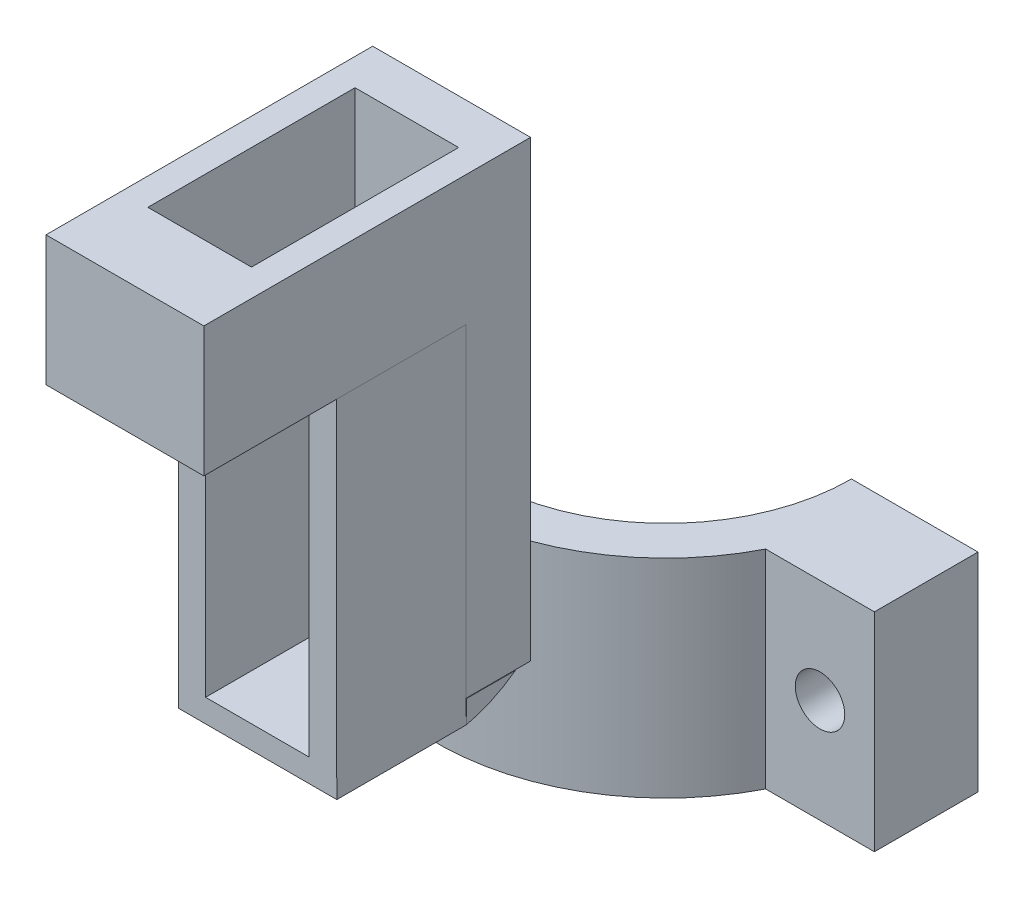
from build123d import *

# Parameters (mm, degrees)
SKETCH_1_R                = 17.63
SKETCH_1_R_2              = 14.34
EXTRUDE_1_DEPTH           = 16.05
EXTRUDE_1_2_DEPTH         = 9.77
EXTRUDE_1_2_DEPTH_BACK    = 3
SKETCH_2_W                = 16
SKETCH_2_H                = 16.05
SKETCH_3_W                = 3.41
SKETCH_3_H                = 16
CUT_EXTRUDE_1_DEPTH       = 37.411121927
SKETCH_4_R                = 1.91
CUT_EXTRUDE_2_DEPTH       = 39.675463798
EXTRUDE_2_DEPTH           = 4
EXTRUDE_2_DEPTH_BACK      = 2.77
SKETCH_5_W                = 12.19
SKETCH_5_H                = 8.263625949
SKETCH_6_W                = 12.19
SKETCH_6_H                = 6.77
EXTRUDE_3_DEPTH           = 63
SKETCH_8_W                = 12.19
SKETCH_8_H                = 6.77
EXTRUDE_4_DEPTH           = 0.16
EXTRUDE_5_DEPTH           = 3.16
EXTRUDE_5_DEPTH_BACK      = 10
SKETCH_12_W               = 16
SKETCH_12_H               = 16.05
SKETCH_13_W               = 1.21
SKETCH_13_H               = 16
CUT_EXTRUDE_3_DEPTH       = 73.543164889
SKETCH_14_R               = 1.91
CUT_EXTRUDE_4_DEPTH       = 90.07387176
SKETCH_15_R               = 4.05
CUT_EXTRUDE_5_DEPTH       = 24
SKETCH_16_W               = 56.400519221
SKETCH_16_H               = 19.935010357
CUT_EXTRUDE_6_DEPTH       = 73.088971918
SKETCH_17_W               = 12.19
SKETCH_17_H               = 71.423625949
EXTRUDE_7_DEPTH           = 25
SKETCH_18_W               = 26.793372528
SKETCH_18_H               = 63.398625949
CUT_EXTRUDE_7_DEPTH       = 25
SKETCH_19_R               = 4
CUT_EXTRUDE_8_DEPTH       = 24
CUT_EXTRUDE_9_DEPTH       = 29
EXTRUDE_9_DEPTH           = 2
FILLET_1_R                = 10
SKETCH_24_W               = 12.19
SKETCH_24_H               = 5
EXTRUDE_10_DEPTH          = 27
SKETCH_27_W               = 12.19
SKETCH_27_H               = 10.03
EXTRUDE_11_DEPTH          = 20.23
CUT_EXTRUDE_10_DEPTH      = 45.23
CUT_EXTRUDE_10_DEPTH_BACK = 8
SKETCH_21_W               = 8
SKETCH_21_H               = 16
SKETCH_25_W               = 20.230462415
SKETCH_25_H               = 10.025
CUT_EXTRUDE_12_DEPTH      = 20.23
SKETCH_31_W               = 8
SKETCH_31_H               = 2.03
EXTRUDE_13_DEPTH          = 16.23
EXTRUDE_17_DEPTH          = 10


with BuildPart() as part:
    # 草圖1 → Extrude 1 (new body)
    with BuildSketch(Plane(origin=(0, 0, 0), x_dir=(1, 0, 0), z_dir=(0, 1, 0))):
        Circle(SKETCH_1_R)
        Circle(SKETCH_1_R_2, mode=Mode.SUBTRACT)
    extrude(amount=EXTRUDE_1_DEPTH)

    # 草圖2 → Extrude 1 2 (add, two sides: drawn at the far end of the back side and taken through both)
    with BuildSketch(Plane(origin=(17.75, 0, 0), x_dir=(0, 0, -1), z_dir=(1, 0, 0)).offset(-EXTRUDE_1_2_DEPTH_BACK)):
        with Locations((0, 8.025)):
            Rectangle(SKETCH_2_W, SKETCH_2_H)
    extrude(amount=EXTRUDE_1_2_DEPTH + EXTRUDE_1_2_DEPTH_BACK)

    # 草圖3 → 除料-伸長1 (cut, through all)
    with BuildSketch(Plane(origin=(0, 16.05, 0), x_dir=(1, 0, 0), z_dir=(0, 1, 0))):
        with Locations((25.815, 0)):
            Rectangle(SKETCH_3_W, SKETCH_3_H)
    extrude(amount=-CUT_EXTRUDE_1_DEPTH, mode=Mode.SUBTRACT)

    # 草圖4 → 除料-伸長2 (cut, through all)
    with BuildSketch(Plane.XY.offset(8)):
        with Locations((19.910203689, 8.025)):
            Circle(SKETCH_4_R)
    extrude(amount=-CUT_EXTRUDE_2_DEPTH, mode=Mode.SUBTRACT)

    # 草圖5 → 填料-伸長2 (add, two sides: drawn at the far end of the back side and taken through both)
    with BuildSketch(Plane.XY.offset(17.75).offset(-EXTRUDE_2_DEPTH_BACK)):
        with Locations((0, 12.156812974)):
            Rectangle(SKETCH_5_W, SKETCH_5_H)
    extrude(amount=EXTRUDE_2_DEPTH + EXTRUDE_2_DEPTH_BACK)

    # 草圖6 → 填料-伸長3 (add)
    with BuildSketch(Plane(origin=(0, 16.288625949, 0), x_dir=(1, 0, 0), z_dir=(0, 1, 0))):
        with Locations((0, -18.365)):
            Rectangle(SKETCH_6_W, SKETCH_6_H)
    extrude(amount=EXTRUDE_3_DEPTH)

    # 草圖8 → 填料-伸長4 (add)
    with BuildSketch(Plane(origin=(0, 79.288625949, 0), x_dir=(1, 0, 0), z_dir=(0, 1, 0))):
        with Locations((0, -18.365)):
            Rectangle(SKETCH_8_W, SKETCH_8_H)
    extrude(amount=EXTRUDE_4_DEPTH)

    # 草圖12 → 填料-伸長5 (add, two sides: drawn at the far end of the back side and taken through both)
    with BuildSketch(Plane(origin=(-17.75, 0, 0), x_dir=(0, 0, -1), z_dir=(1, 0, 0)).offset(-EXTRUDE_5_DEPTH_BACK)):
        with Locations((0.543544944, 8.025)):
            Rectangle(SKETCH_12_W, SKETCH_12_H)
    extrude(amount=EXTRUDE_5_DEPTH + EXTRUDE_5_DEPTH_BACK)

    # 草圖13 → 除料-伸長3 (cut, through all)
    with BuildSketch(Plane(origin=(0, 16.05, 0), x_dir=(1, 0, 0), z_dir=(0, 1, 0))):
        with Locations((-27.145, 0.543544944)):
            Rectangle(SKETCH_13_W, SKETCH_13_H)
    extrude(amount=-CUT_EXTRUDE_3_DEPTH, mode=Mode.SUBTRACT)

    # 草圖14 → 除料-伸長4 (cut, through all)
    with BuildSketch(Plane(origin=(0, 0, -8.543544944), x_dir=(-1, 0, 0), z_dir=(0, 0, -1))):
        with Locations(Location((20.980783679, 8.025, 0), (0, 0, 90))):
            Circle(SKETCH_14_R)
    extrude(amount=-CUT_EXTRUDE_4_DEPTH, mode=Mode.SUBTRACT)

    # 草圖15 → 除料-伸長5 (cut)
    with BuildSketch(Plane(origin=(0, 79.448625949, 0), x_dir=(1, 0, 0), z_dir=(0, 1, 0))):
        with Locations((0, -14.98)):
            Circle(SKETCH_15_R)
    extrude(amount=-CUT_EXTRUDE_5_DEPTH, mode=Mode.SUBTRACT)

    # 草圖16 → 除料-伸長6 (cut, through all)
    with BuildSketch(Plane(origin=(0, 16.05, 0), x_dir=(1, 0, 0), z_dir=(0, 1, 0))):
        with Locations((-4.090259611, 9.967505179)):
            Rectangle(SKETCH_16_W, SKETCH_16_H)
    extrude(amount=-CUT_EXTRUDE_6_DEPTH, mode=Mode.SUBTRACT)

    # 草圖17 → 填料-伸長7 (add)
    with BuildSketch(Plane.XY.offset(21.75)):
        with Locations((0, 43.736812975)):
            Rectangle(SKETCH_17_W, SKETCH_17_H)
    extrude(amount=EXTRUDE_7_DEPTH)

    # 草圖18 → 除料-伸長7 (cut)
    with BuildSketch(Plane.ZY.offset(6.095)):
        with Locations((28.376686264, 47.749312975)):
            Rectangle(SKETCH_18_W, SKETCH_18_H)
    extrude(amount=-CUT_EXTRUDE_7_DEPTH, mode=Mode.SUBTRACT)

    # 草圖19 → 除料-伸長8 (cut)
    with BuildSketch(Plane(origin=(0, 79.448625949, 0), x_dir=(1, 0, 0), z_dir=(0, 1, 0))):
        with Locations((0, -41.773372528)):
            Circle(SKETCH_19_R)
    extrude(amount=-CUT_EXTRUDE_8_DEPTH, mode=Mode.SUBTRACT)

    # 草圖20 → 除料-伸長9 (cut)
    with BuildSketch(Plane(origin=(6.095, 0, 0), x_dir=(0, 0, -1), z_dir=(1, 0, 0))):
        Polygon((-41.773372528, 16.05), (-41.773372528, 8.025), (-46.75, 8.025), (-46.75, 79.448625949), (-41.773372528, 79.448625949), align=None)
    extrude(amount=-CUT_EXTRUDE_9_DEPTH, mode=Mode.SUBTRACT)

    # 草圖23 → 填料-伸長9 (add)
    with BuildSketch(Plane.XZ.offset(-8.025)):
        Polygon((-6.095, 41.773372528), (-6.095, 17.75), (6.13829314, 17.75), (6.095, 41.773372528), align=None)
    extrude(amount=EXTRUDE_9_DEPTH)

    # 圓角1
    # the kernel refuses this fillet: 10 mm, written as the material it takes off along each edge
    with BuildSketch(Plane(origin=(-21.095, 6.025, 17.75), x_dir=(0, 1, 0), z_dir=(1, 0, 0))) as fillet_1_piece_1:
        with BuildLine():
            CenterArc((10, 6), FILLET_1_R, 180, 36.869897646)
            Line((0, 6), (0, 0))
            Line((0, 0), (2, 0))
        make_face()
    extrude(amount=42.23329314, mode=Mode.SUBTRACT)

    # 草圖24 → 填料-伸長10 (add)
    with BuildSketch(Plane(origin=(0, 16.05, 0), x_dir=(1, 0, 0), z_dir=(0, 1, 0))):
        with Locations((0, -19.042910113)):
            Rectangle(SKETCH_24_W, SKETCH_24_H)
    extrude(amount=EXTRUDE_10_DEPTH)

    # 草圖27 → 填料-伸長11 (add)
    with BuildSketch(Plane.XY.offset(21.542910113)):
        with Locations((0, 38.035)):
            Rectangle(SKETCH_27_W, SKETCH_27_H)
    extrude(amount=EXTRUDE_11_DEPTH)

    # 草圖21 → 除料-伸長10 (cut, two sides: drawn at the far end of the back side and taken through both)
    with BuildSketch(Plane(origin=(0, 16.05, 0), x_dir=(1, 0, 0), z_dir=(0, 1, 0)).offset(-CUT_EXTRUDE_10_DEPTH_BACK)):
        with Locations((0, -28)):
            Rectangle(SKETCH_21_W, SKETCH_21_H)
    extrude(amount=CUT_EXTRUDE_10_DEPTH + CUT_EXTRUDE_10_DEPTH_BACK, mode=Mode.SUBTRACT)

    # 草圖25 → 除料-伸長12 (cut)
    with BuildSketch(Plane.ZY.offset(6.095)):
        with Locations((31.658141321, 11.0375)):
            Rectangle(SKETCH_25_W, SKETCH_25_H)
    extrude(amount=-CUT_EXTRUDE_12_DEPTH, mode=Mode.SUBTRACT)

    # 草圖31 → 填料-伸長13 (add)
    with BuildSketch(Plane(origin=(0, 0, 36), x_dir=(-1, 0, 0), z_dir=(0, 0, -1))):
        with Locations((0, 34.035)):
            Rectangle(SKETCH_31_W, SKETCH_31_H)
    extrude(amount=EXTRUDE_13_DEPTH)

    # 草圖33 → 填料-伸長17 (add)
    with BuildSketch(Plane.XY.offset(21.542910113)):
        Polygon((-6.095, 33.02), (-4, 33.02), (-4, 8.05), (4, 8.05), (4, 33.02), (6.095, 33.02), (6.131457839, 6.271602939), (-6.095, 6.271602939), align=None)
    extrude(amount=EXTRUDE_17_DEPTH)


solid = part.part
